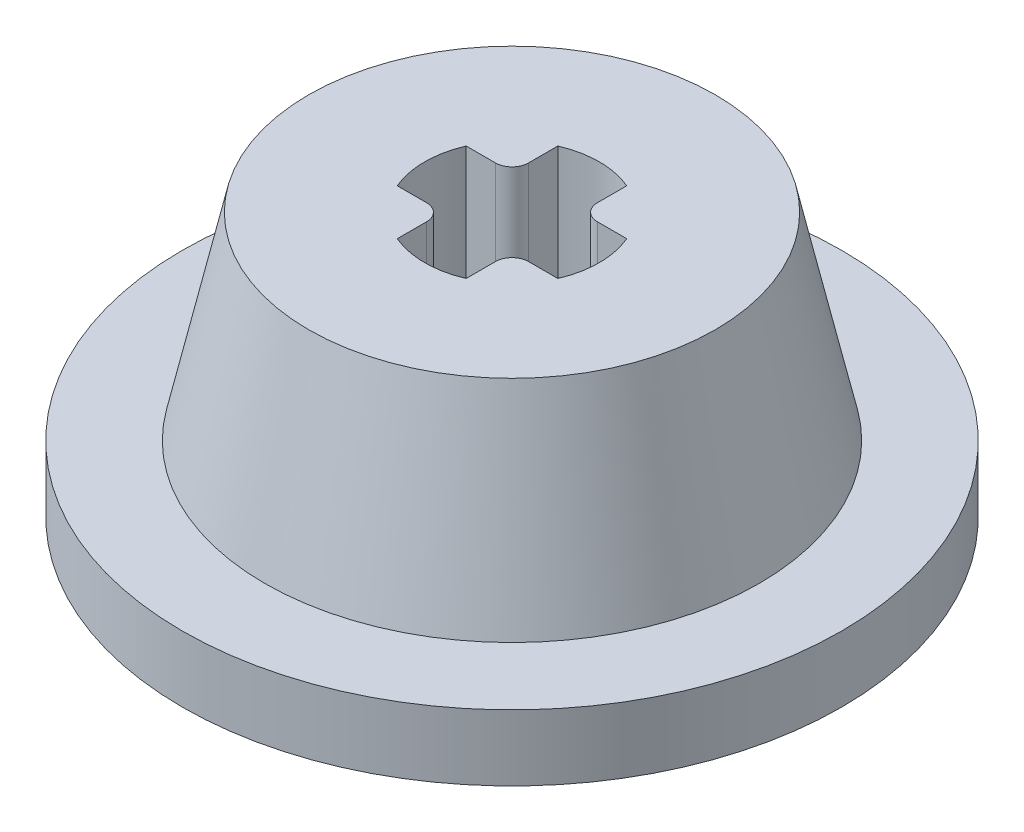
from build123d import *

# Parameters (mm, degrees)
SKETCH1_R           = 7.5
BOSS_EXTRUDE1_DEPTH = 6
SKETCH3_R           = 10
BOSS_EXTRUDE2_DEPTH = 2
CUT_EXTRUDE1_DEPTH  = 17.248076809
FILLET1_R           = 0.5


with BuildPart() as part:
    # Sketch1 → Boss-Extrude1 (new body)
    with BuildSketch(Plane(origin=(0, 0, 0), x_dir=(1, 0, 0), z_dir=(0, 1, 0))):
        Circle(SKETCH1_R)
    extrude(amount=BOSS_EXTRUDE1_DEPTH)

    # Sketch2 → Cut-Revolve1 (revolve, cut)
    with BuildSketch(Plane(origin=(0, 0, 0), x_dir=(0, 0, -1), z_dir=(1, 0, 0))):
        Polygon((-7.5, 0), (-6.169832024, 6), (-7.5, 6), align=None)
    revolve(axis=Axis((0, 0, 0), (0, 1, 0)), mode=Mode.SUBTRACT)

    # Sketch3 → Boss-Extrude2 (add)
    with BuildSketch(Plane(origin=(0, 0, 0), x_dir=(-1, 0, 0), z_dir=(0, -1, 0))):
        Circle(SKETCH3_R)
    extrude(amount=BOSS_EXTRUDE2_DEPTH)

    # Sketch4 → Cut-Extrude1 (cut, through all)
    with BuildSketch(Plane.XZ.offset(2)):
        with BuildLine():
            ThreePointArc((-1.045, -2.43525666), (0, -2.65), (1.045, -2.43525666))
            Line((1.045, -2.43525666), (1.045, -1.045))
            Line((1.045, -1.045), (2.43525666, -1.045))
            ThreePointArc((2.43525666, -1.045), (2.65, 0), (2.43525666, 1.045))
            Line((2.43525666, 1.045), (1.045, 1.045))
            Line((1.045, 1.045), (1.045, 2.43525666))
            ThreePointArc((1.045, 2.43525666), (0, 2.65), (-1.045, 2.43525666))
            Line((-1.045, 2.43525666), (-1.045, 1.045))
            Line((-1.045, 1.045), (-2.43525666, 1.045))
            ThreePointArc((-2.43525666, 1.045), (-2.65, 0), (-2.43525666, -1.045))
            Line((-2.43525666, -1.045), (-1.045, -1.045))
            Line((-1.045, -1.045), (-1.045, -2.43525666))
        make_face()
    extrude(amount=-CUT_EXTRUDE1_DEPTH, mode=Mode.SUBTRACT)

    # Fillet1
    fillet1_edges = [part.edges().sort_by_distance(p)[0] for p in [
        (1.045, 2, 1.045),
        (1.045, 2, -1.045),
        (-1.045, 2, -1.045),
        (-1.045, 2, 1.045),
    ]]
    fillet(fillet1_edges, radius=FILLET1_R)


solid = part.part
